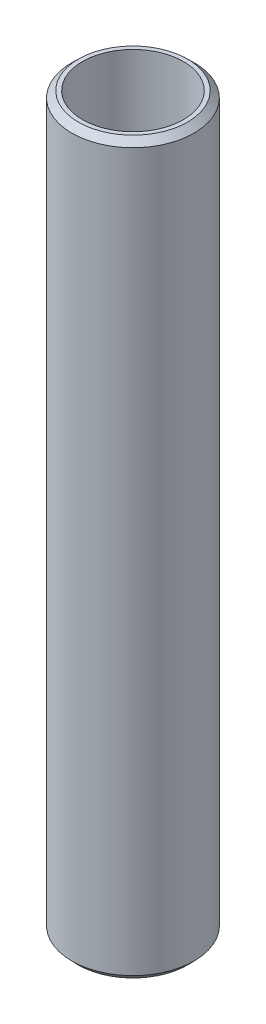
from build123d import *
from OCP.BRepFilletAPI import BRepFilletAPI_MakeChamfer

# Parameters (mm, degrees)
SKETCH1_R           = 30
BOSS_EXTRUDE1_DEPTH = 358.177548738
SKETCH2_R           = 24.758556216
CUT_EXTRUDE1_DEPTH  = 361.681516604
CHAMFER1_SIZE       = 3.085635676
CHAMFER1_SIZE2      = 3.191231043


with BuildPart() as part:
    # Sketch1 → Boss-Extrude1 (new body)
    with BuildSketch(Plane(origin=(0, 0, 0), x_dir=(1, 0, 0), z_dir=(0, 1, 0))):
        Circle(SKETCH1_R)
    extrude(amount=BOSS_EXTRUDE1_DEPTH)

    # Sketch2 → Cut-Extrude1 (cut, through all)
    with BuildSketch(Plane(origin=(0, 0, 0), x_dir=(1, 0, 0), z_dir=(0, 1, 0))):
        Circle(SKETCH2_R)
    extrude(amount=CUT_EXTRUDE1_DEPTH, mode=Mode.SUBTRACT)

    # Chamfer1: one chamfer whose edges measure the first distance from different faces: ONE call of the kernel's chamfer builder (chamfer() names one face for all edges)
    chamfer1_edges_1 = [part.edges().sort_by_distance(p)[0] for p in [
        (-30, 358.177548738, 0),
    ]]
    chamfer1_side_1 = [part.faces().sort_by_distance(p)[0] for p in [
        (-30, 179.088774369, 0),
    ]]
    chamfer1_edges_2 = [part.edges().sort_by_distance(p)[0] for p in [
        (-30, 0, 0),
    ]]
    chamfer1_side_2 = [part.faces().sort_by_distance(p)[0] for p in [
        (-29.151471863, 0, 0),
    ]]
    chamfer1 = BRepFilletAPI_MakeChamfer(part.part.solid().wrapped)
    for e in chamfer1_edges_1:
        chamfer1.Add(CHAMFER1_SIZE, CHAMFER1_SIZE2, e.wrapped, chamfer1_side_1[0].wrapped)  # the first distance lies on this face
    for e in chamfer1_edges_2:
        chamfer1.Add(CHAMFER1_SIZE, CHAMFER1_SIZE2, e.wrapped, chamfer1_side_2[0].wrapped)  # the first distance lies on this face
    add(Compound.cast(chamfer1.Shape()), mode=Mode.REPLACE)


solid = part.part
